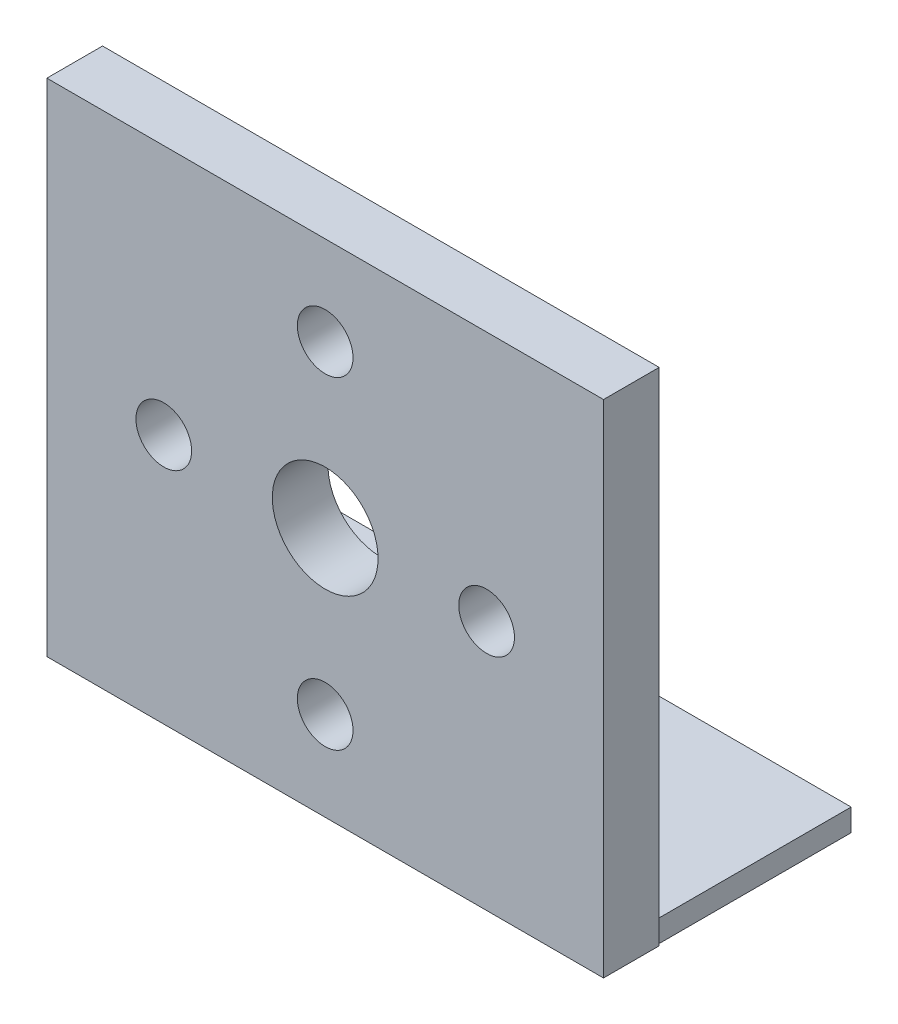
from build123d import *

# Parameters (mm, degrees)
BOSS_EXTRUDE3_DEPTH      = 2.5
BOSS_EXTRUDE3_DEPTH_BACK = 2.5
SKETCH1_R                = 2.5
SKETCH1_R_2              = 4.75
SKETCH2_W                = 49.557852449
SKETCH2_H                = 2
BOSS_EXTRUDE4_DEPTH      = 20


with BuildPart() as part:
    # Sketch1 → Boss-Extrude3 (new, two sides: drawn at the far end of the back side and taken through both)
    with BuildSketch(Plane.XY.offset(-BOSS_EXTRUDE3_DEPTH_BACK)):
        Polygon((-25, -22.5), (25, -22.5), (25, -22.416343003), (25, 22.5), (-25, 22.5), align=None)
        with Locations((0, -14.5)):
            Circle(SKETCH1_R, mode=Mode.SUBTRACT)
        with Locations((14.5, 0)):
            Circle(SKETCH1_R, mode=Mode.SUBTRACT)
        with Locations((-14.5, 0)):
            Circle(SKETCH1_R, mode=Mode.SUBTRACT)
        Circle(SKETCH1_R_2, mode=Mode.SUBTRACT)
        with Locations((0, 14.5)):
            Circle(SKETCH1_R, mode=Mode.SUBTRACT)
    extrude(amount=BOSS_EXTRUDE3_DEPTH + BOSS_EXTRUDE3_DEPTH_BACK)

    # Sketch2 → Boss-Extrude4 (add)
    with BuildSketch(Plane.XY):
        with Locations((-0.035916377, -21.578559602)):
            Rectangle(SKETCH2_W, SKETCH2_H)
    extrude(amount=-BOSS_EXTRUDE4_DEPTH)


solid = part.part
